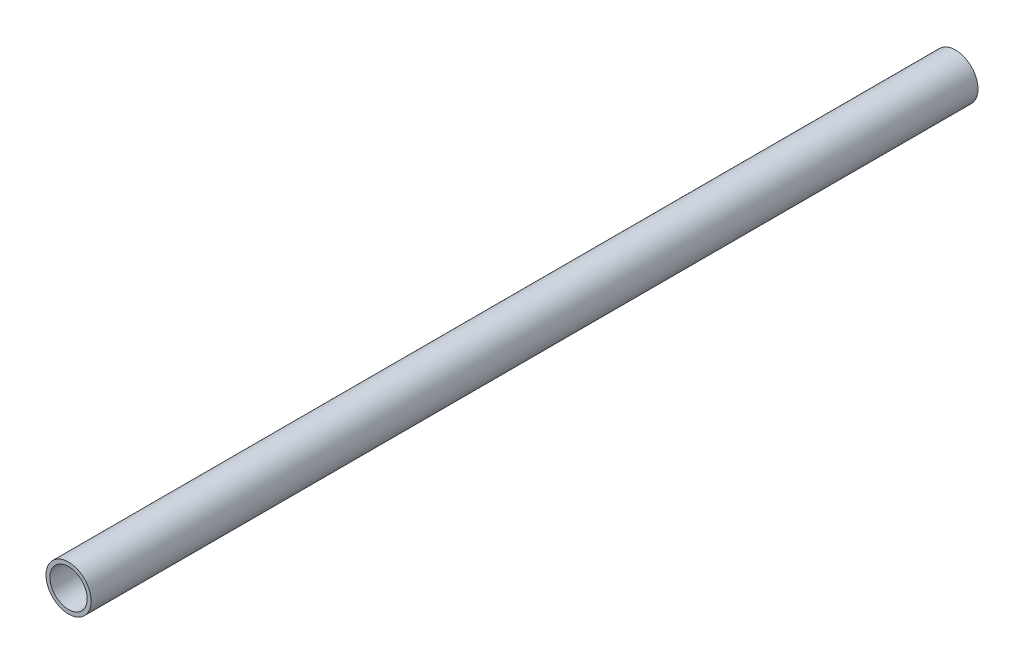
from build123d import *

# Parameters (mm, degrees)
SKETCH3_R           = 9.525
SKETCH3_R_2         = 7.874
BOSS_EXTRUDE1_DEPTH = 187.325


with BuildPart() as part:
    # Sketch3 → Boss-Extrude1 (new, symmetric)
    with BuildSketch(Plane.XY):
        Circle(SKETCH3_R)
        Circle(SKETCH3_R_2, mode=Mode.SUBTRACT)
    extrude(amount=BOSS_EXTRUDE1_DEPTH, both=True)


solid = part.part
